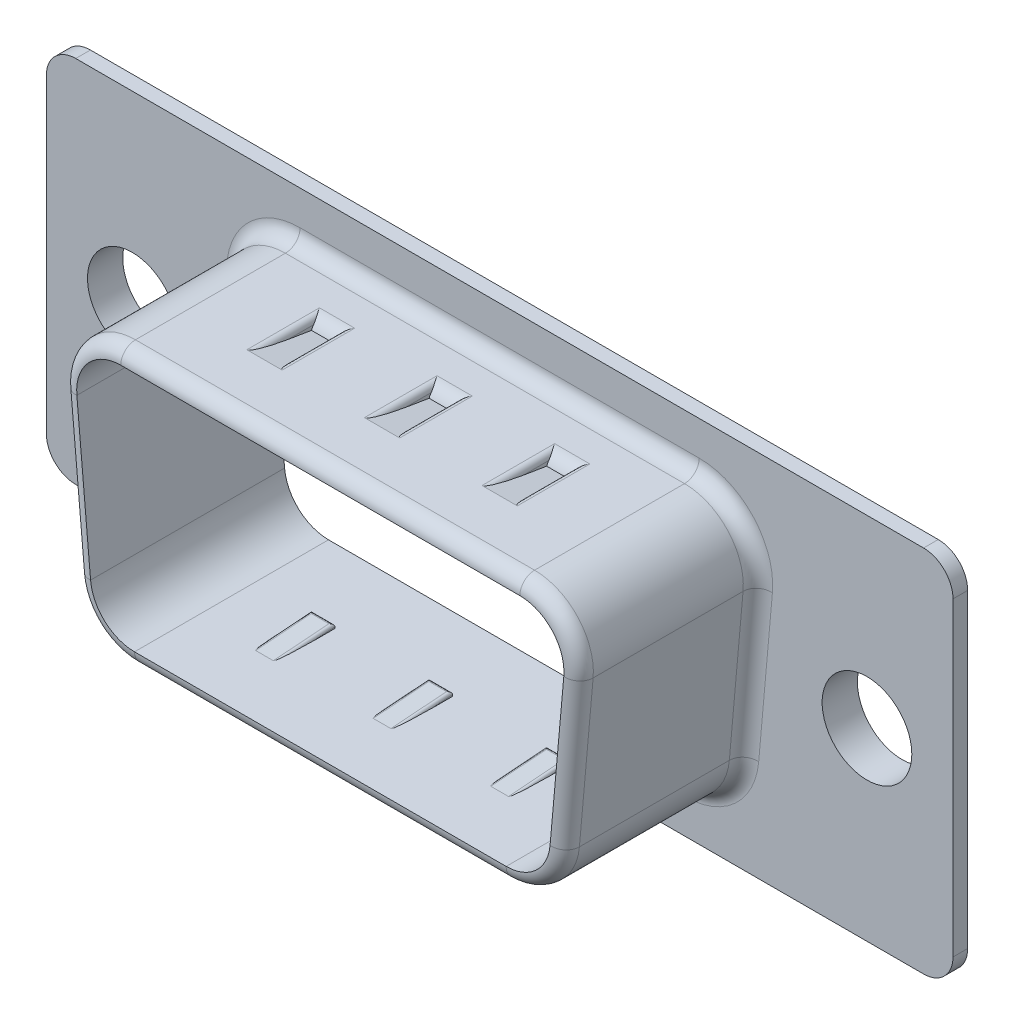
from build123d import *
from build123d.topology import SkipClean

# Parameters (mm, degrees)
BOSS_EXTRUDE1_DEPTH  = 0.5
SKETCH2_R            = 1.525
CUT_EXTRUDE1_DEPTH   = 20.28320582
BOSS_EXTRUDE2_DEPTH  = 6.1
FILLET1_R            = 0.5
CUT_EXTRUDE2_DEPTH   = 14.18320582
FILLET2_R            = 0.5
CUT_EXTRUDE3_DEPTH   = 0.4
LPATTERN1_COUNT      = 2
LPATTERN1_PITCH      = 4
LPATTERN2_COUNT      = 2
LPATTERN2_PITCH      = 4
FILLET3_R            = 0.5
MIRROR1_COPY_1_DEPTH = 0.4
MIRROR1_COPY_2_DEPTH = 0.4
FILLET4_START        = 2.5
FILLET4_DEPTH        = 2
FILLET4_START_2      = 2.029787182
FILLET4_2_DEPTH      = 0.470212818
FILLET4_START_3      = -6
FILLET4_3_DEPTH      = 12
SKETCH9_R            = 1.825
SKETCH9_R_2          = 1.525
BOSS_EXTRUDE3_DEPTH  = 0.5
SKETCH10_R           = 2.025
SKETCH10_R_2         = 1.525
BOSS_EXTRUDE4_DEPTH  = 0.2
BOSS_EXTRUDE5_DEPTH  = 0.4
LPATTERN3_COUNT      = 2
LPATTERN3_PITCH      = 4
LPATTERN4_COUNT      = 2
LPATTERN4_PITCH      = 4
MIRROR2_COPY_1_DEPTH = 0.4
MIRROR2_COPY_2_DEPTH = 0.4
FILLET7_R            = 0.1


with BuildPart() as part:
    # Sketch1 → Boss-Extrude1 (new body)
    with BuildSketch(Plane.XY):
        with BuildLine():
            Line((-14.42, 6.275), (14.42, 6.275))
            ThreePointArc((14.42, 6.275), (15.127106781, 5.982106781), (15.42, 5.275))
            Line((15.42, 5.275), (15.42, -5.275))
            ThreePointArc((15.42, -5.275), (15.127106781, -5.982106781), (14.42, -6.275))
            Line((14.42, -6.275), (-14.42, -6.275))
            ThreePointArc((-14.42, -6.275), (-15.127106781, -5.982106781), (-15.42, -5.275))
            Line((-15.42, -5.275), (-15.42, 5.275))
            ThreePointArc((-15.42, 5.275), (-15.127106781, 5.982106781), (-14.42, 6.275))
        make_face()
    extrude(amount=BOSS_EXTRUDE1_DEPTH)

    # Sketch2 → Cut-Extrude1 (cut)
    with BuildSketch(Plane.XY.offset(0.5)):
        with Locations((-12.495, 0)):
            Circle(SKETCH2_R)
        with Locations((12.495, 0)):
            Circle(SKETCH2_R)
    extrude(amount=-CUT_EXTRUDE1_DEPTH, mode=Mode.SUBTRACT)

    # Sketch3 → Boss-Extrude2 (add)
    with BuildSketch(Plane.XY.offset(0.5)):
        with BuildLine():
            Line((-6.787838979, 4.605), (6.787838979, 4.605))
            ThreePointArc((6.787838979, 4.605), (8.263792445, 3.954652313), (8.779862989, 2.426561367))
            Line((8.779862989, 2.426561367), (8.313169178, -2.783438633))
            ThreePointArc((8.313169178, -2.783438633), (7.670797482, -4.080953466), (6.321145168, -4.605))
            Line((6.321145168, -4.605), (-6.321145168, -4.605))
            ThreePointArc((-6.321145168, -4.605), (-7.670797482, -4.080953466), (-8.313169178, -2.783438633))
            Line((-8.313169178, -2.783438633), (-8.779862989, 2.426561367))
            ThreePointArc((-8.779862989, 2.426561367), (-8.263792445, 3.954652313), (-6.787838979, 4.605))
        make_face()
    extrude(amount=BOSS_EXTRUDE2_DEPTH)

    # Fillet1
    fillet1_edges = [part.edges().sort_by_distance(p)[0] for p in [
        (7.670797482, -4.080953466, 0.5),
        (8.546516083, -0.178438633, 0.5),
        (8.263792445, 3.954652313, 0.5),
        (0, 4.605, 0.5),
        (-8.263792445, 3.954652313, 0.5),
        (-8.546516083, -0.178438633, 0.5),
        (-7.670797482, -4.080953466, 0.5),
        (0, -4.605, 0.5),
    ]]
    fillet(fillet1_edges, radius=FILLET1_R)

    # Sketch4 → Cut-Extrude2 (cut)
    with BuildSketch(Plane.XY.offset(6.6)):
        with BuildLine():
            Line((7.815163175, -2.738828975), (8.281856987, 2.471171025))
            ThreePointArc((8.281856987, 2.471171025), (7.894804079, 3.617239235), (6.787838979, 4.105))
            Line((6.787838979, 4.105), (-6.787838979, 4.105))
            ThreePointArc((-6.787838979, 4.105), (-7.894804079, 3.617239235), (-8.281856987, 2.471171025))
            Line((-8.281856987, 2.471171025), (-7.815163175, -2.738828975))
            ThreePointArc((-7.815163175, -2.738828975), (-7.333384403, -3.711965099), (-6.321145168, -4.105))
            Line((-6.321145168, -4.105), (6.321145168, -4.105))
            ThreePointArc((6.321145168, -4.105), (7.333384403, -3.711965099), (7.815163175, -2.738828975))
        make_face()
    extrude(amount=-CUT_EXTRUDE2_DEPTH, mode=Mode.SUBTRACT)

    # Fillet2
    fillet2_edges = [part.edges().sort_by_distance(p)[0] for p in [
        (7.670797482, -4.080953466, 6.6),
        (8.546516083, -0.178438633, 6.6),
        (8.263792445, 3.954652313, 6.6),
        (0, 4.605, 6.6),
        (-8.263792445, 3.954652313, 6.6),
        (-8.546516083, -0.178438633, 6.6),
        (-7.670797482, -4.080953466, 6.6),
        (0, -4.605, 6.6),
    ]]
    fillet(fillet2_edges, radius=FILLET2_R - 0.0001)  # a hair under: the kernel refuses the full size

    # Sketch8 → Cut-Extrude3 (cut, symmetric)
    with BuildSketch(Plane(origin=(0, 0, 0), x_dir=(0, 0, -1), z_dir=(1, 0, 0))):
        Polygon((-4.5, 4.605), (-2.5, 4.275), (-2.5, 4.605), align=None)
    cut_extrude3 = extrude(amount=CUT_EXTRUDE3_DEPTH, both=True, mode=Mode.SUBTRACT)

    # LPattern1: Cut-Extrude3 ×2
    with Locations(*[(i * LPATTERN1_PITCH, 0, 0) for i in range(1, LPATTERN1_COUNT)]):
        add(cut_extrude3, mode=Mode.SUBTRACT)

    # LPattern2: Cut-Extrude3 ×2
    with Locations(*[(-i * LPATTERN2_PITCH, 0, 0) for i in range(1, LPATTERN2_COUNT)]):
        add(cut_extrude3, mode=Mode.SUBTRACT)

    # Fillet3
    # the kernel refuses this fillet: 0.5 mm, written as the material it takes off along each edge
    with BuildSketch(Plane(origin=(4.4, 4.605, 2.5), x_dir=(0, 0, -1), z_dir=(-1, 0, 0)), Plane(origin=(0.4, 4.605, 2.5), x_dir=(0, 0, -1), z_dir=(-1, 0, 0)), Plane(origin=(-3.6, 4.605, 2.5), x_dir=(0, 0, -1), z_dir=(-1, 0, 0))) as fillet3_piece_1:
        with BuildLine():
            CenterArc((0.470212718, 0.5), FILLET3_R, 199.87687407, 70.12312593)
            Line((0, 0.33), (-0.009404254, 0.3266))
            ThreePointArc((-0.009404254, 0.3266), (-0.01, 0.165), (-0.01, 0))
            Line((-0.01, 0), (0, -0.01))
            Line((0, -0.01), (0.470212718, -0.01))
            Line((0.470212718, -0.01), (0.470212718, 0))
        make_face()
    extrude(amount=0.8, mode=Mode.SUBTRACT)

    # Mirror1: Cut-Extrude3 across plane
    add(cut_extrude3.mirror(Plane.ZX), mode=Mode.SUBTRACT)

    # Mirror1 copy 1 sketch → Mirror1 copy 1 (cut, symmetric)
    with BuildSketch(Plane(origin=(4, 0, 0), x_dir=(0, 0, -1), z_dir=(1, 0, 0))):
        Polygon((-4.5, -4.605), (-2.5, -4.275), (-2.5, -4.605), align=None)
    extrude(amount=MIRROR1_COPY_1_DEPTH, both=True, mode=Mode.SUBTRACT)

    # Mirror1 copy 2 sketch → Mirror1 copy 2 (cut, symmetric)
    with BuildSketch(Plane(origin=(-4, 0, 0), x_dir=(0, 0, -1), z_dir=(1, 0, 0))):
        Polygon((-4.5, -4.605), (-2.5, -4.275), (-2.5, -4.605), align=None)
    extrude(amount=MIRROR1_COPY_2_DEPTH, both=True, mode=Mode.SUBTRACT)

    # Fillet4: read off the stored shape, not the designer's step
    # Fillet4 outline → Fillet4 (cut)
    with BuildSketch(Plane.XY.offset(FILLET4_START)):
        with BuildLine():
            Line((4.4, -4.405), (4.4, -4.605))
            Line((4.4, -4.605), (4.6, -4.605))
            ThreePointArc((4.6, -4.605), (4.458578644, -4.546421356), (4.4, -4.405))
        make_face()
        with BuildLine():
            ThreePointArc((3.6, -4.405), (3.541421356, -4.546421356), (3.4, -4.605))
            Line((3.4, -4.605), (3.6, -4.605))
            Line((3.6, -4.605), (3.6, -4.405))
        make_face()
        with BuildLine():
            Line((0.4, -4.405), (0.4, -4.605))
            Line((0.4, -4.605), (0.6, -4.605))
            ThreePointArc((0.6, -4.605), (0.458578644, -4.546421356), (0.4, -4.405))
        make_face()
        with BuildLine():
            ThreePointArc((-0.4, -4.405), (-0.458578644, -4.546421356), (-0.6, -4.605))
            Line((-0.6, -4.605), (-0.4, -4.605))
            Line((-0.4, -4.605), (-0.4, -4.405))
        make_face()
        with BuildLine():
            Line((-3.6, -4.405), (-3.6, -4.605))
            Line((-3.6, -4.605), (-3.4, -4.605))
            ThreePointArc((-3.4, -4.605), (-3.541421356, -4.546421356), (-3.6, -4.405))
        make_face()
        with BuildLine():
            ThreePointArc((-4.4, -4.405), (-4.458578644, -4.546421356), (-4.6, -4.605))
            Line((-4.6, -4.605), (-4.4, -4.605))
            Line((-4.4, -4.605), (-4.4, -4.405))
        make_face()
        with BuildLine():
            Line((4.6, 4.605), (4.4, 4.605))
            Line((4.4, 4.605), (4.4, 4.405))
            ThreePointArc((4.4, 4.405), (4.458578644, 4.546421356), (4.6, 4.605))
        make_face()
        with BuildLine():
            Line((3.6, 4.605), (3.4, 4.605))
            ThreePointArc((3.4, 4.605), (3.541421356, 4.546421356), (3.6, 4.405))
            Line((3.6, 4.405), (3.6, 4.605))
        make_face()
        with BuildLine():
            Line((0.6, 4.605), (0.4, 4.605))
            Line((0.4, 4.605), (0.4, 4.405))
            ThreePointArc((0.4, 4.405), (0.458578644, 4.546421356), (0.6, 4.605))
        make_face()
        with BuildLine():
            Line((-0.4, 4.605), (-0.6, 4.605))
            ThreePointArc((-0.6, 4.605), (-0.458578644, 4.546421356), (-0.4, 4.405))
            Line((-0.4, 4.405), (-0.4, 4.605))
        make_face()
        with BuildLine():
            Line((-3.4, 4.605), (-3.6, 4.605))
            Line((-3.6, 4.605), (-3.6, 4.405))
            ThreePointArc((-3.6, 4.405), (-3.541421356, 4.546421356), (-3.4, 4.605))
        make_face()
        with BuildLine():
            ThreePointArc((-4.6, 4.605), (-4.458578644, 4.546421356), (-4.4, 4.405))
            Line((-4.4, 4.405), (-4.4, 4.605))
            Line((-4.4, 4.605), (-4.6, 4.605))
        make_face()
    extrude(amount=FILLET4_DEPTH, mode=Mode.SUBTRACT)

    # Fillet4 2 outline → Fillet4 2 (cut)
    with BuildSketch(Plane.XY.offset(FILLET4_START_2)):
        with BuildLine():
            Line((4.6, 4.605), (4.4, 4.605))
            Line((4.4, 4.605), (4.4, 4.405))
            ThreePointArc((4.4, 4.405), (4.458578644, 4.546421356), (4.6, 4.605))
        make_face()
        with BuildLine():
            Line((3.6, 4.605), (3.4, 4.605))
            ThreePointArc((3.4, 4.605), (3.541421356, 4.546421356), (3.6, 4.405))
            Line((3.6, 4.405), (3.6, 4.605))
        make_face()
        with BuildLine():
            Line((0.6, 4.605), (0.4, 4.605))
            Line((0.4, 4.605), (0.4, 4.405))
            ThreePointArc((0.4, 4.405), (0.458578644, 4.546421356), (0.6, 4.605))
        make_face()
        with BuildLine():
            Line((-0.4, 4.605), (-0.6, 4.605))
            ThreePointArc((-0.6, 4.605), (-0.458578644, 4.546421356), (-0.4, 4.405))
            Line((-0.4, 4.405), (-0.4, 4.605))
        make_face()
        with BuildLine():
            Line((-3.4, 4.605), (-3.6, 4.605))
            Line((-3.6, 4.605), (-3.6, 4.405))
            ThreePointArc((-3.6, 4.405), (-3.541421356, 4.546421356), (-3.4, 4.605))
        make_face()
        with BuildLine():
            ThreePointArc((-4.6, 4.605), (-4.458578644, 4.546421356), (-4.4, 4.405))
            Line((-4.4, 4.405), (-4.4, 4.605))
            Line((-4.4, 4.605), (-4.6, 4.605))
        make_face()
    extrude(amount=FILLET4_2_DEPTH, mode=Mode.SUBTRACT)

    # Fillet4 3 outline → Fillet4 3 (add)
    with SkipClean():  # the faces are left unmerged after this step: merging them gives an invalid solid
        with BuildSketch(Plane.YZ.offset(FILLET4_START_3)):
            Polygon((4.405, 4.5), (4.405, 3.287878788), (4.605, 4.5), align=None)
            with BuildLine():
                Line((4.405, 2.429787282), (4.405, 2.029787182))
                Line((4.405, 2.029787182), (4.605, 2.029787282))
                ThreePointArc((4.605, 2.029787282), (4.552213595, 2.25339408), (4.405, 2.429787282))
            make_face()
            Polygon((-4.405, 4.5), (-4.605, 4.5), (-4.405, 3.287878788), align=None)
        extrude(amount=FILLET4_3_DEPTH)

    # Sketch9 → Boss-Extrude3 (add)
    # profile 1 of 2: a face of its own
    with BuildSketch(Plane(origin=(0, 0, 0), x_dir=(-1, 0, 0), z_dir=(0, 0, -1))):
        with Locations((-12.495, 0)):
            Circle(SKETCH9_R)
        with Locations(Location((-12.495, 0, 0), (0, 0, 180))):
            Circle(SKETCH9_R_2, mode=Mode.SUBTRACT)
    # profile 2 of 2: a face of its own
    with BuildSketch(Plane(origin=(0, 0, 0), x_dir=(-1, 0, 0), z_dir=(0, 0, -1))):
        with Locations((12.495, 0)):
            Circle(SKETCH9_R)
        with Locations(Location((12.495, 0, 0), (0, 0, 180))):
            Circle(SKETCH9_R_2, mode=Mode.SUBTRACT)
    extrude(amount=BOSS_EXTRUDE3_DEPTH)

    # Sketch10 → Boss-Extrude4 (add)
    # profile 1 of 2: a face of its own
    with BuildSketch(Plane(origin=(0, 0, -0.5), x_dir=(-1, 0, 0), z_dir=(0, 0, -1))):
        with Locations((-12.495, 0)):
            Circle(SKETCH10_R)
        with Locations(Location((-12.495, 0, 0), (0, 0, 180))):
            Circle(SKETCH10_R_2, mode=Mode.SUBTRACT)
    # profile 2 of 2: a face of its own
    with BuildSketch(Plane(origin=(0, 0, -0.5), x_dir=(-1, 0, 0), z_dir=(0, 0, -1))):
        with Locations((12.495, 0)):
            Circle(SKETCH10_R)
        with Locations(Location((12.495, 0, 0), (0, 0, 180))):
            Circle(SKETCH10_R_2, mode=Mode.SUBTRACT)
    extrude(amount=BOSS_EXTRUDE4_DEPTH)

    # Sketch13 → Boss-Extrude5 (add, symmetric)
    with BuildSketch(Plane(origin=(0, 0, 0), x_dir=(0, 0, -1), z_dir=(1, 0, 0))):
        Polygon((-2.5, 4.105), (-4.5, 4.105), (-2.5, 3.955), align=None)
    boss_extrude5 = extrude(amount=BOSS_EXTRUDE5_DEPTH, both=True)

    # LPattern3: Boss-Extrude5 ×2
    with Locations(*[(-i * LPATTERN3_PITCH, 0, 0) for i in range(1, LPATTERN3_COUNT)]):
        add(boss_extrude5)

    # LPattern4: Boss-Extrude5 ×2
    with Locations(*[(i * LPATTERN4_PITCH, 0, 0) for i in range(1, LPATTERN4_COUNT)]):
        add(boss_extrude5)

    # Mirror2: Boss-Extrude5 across plane
    add(boss_extrude5.mirror(Plane.ZX))

    # Mirror2 copy 1 sketch → Mirror2 copy 1 (add, symmetric)
    with BuildSketch(Plane(origin=(-4, 0, 0), x_dir=(0, 0, -1), z_dir=(1, 0, 0))):
        Polygon((-2.5, -4.105), (-4.5, -4.105), (-2.5, -3.955), align=None)
    extrude(amount=MIRROR2_COPY_1_DEPTH, both=True)

    # Mirror2 copy 2 sketch → Mirror2 copy 2 (add, symmetric)
    with BuildSketch(Plane(origin=(4, 0, 0), x_dir=(0, 0, -1), z_dir=(1, 0, 0))):
        Polygon((-2.5, -4.105), (-4.5, -4.105), (-2.5, -3.955), align=None)
    extrude(amount=MIRROR2_COPY_2_DEPTH, both=True)

    # Fillet7
    # the kernel refuses this fillet: 0.1 mm, written as the material it takes off along each edge
    with BuildSketch(Plane(origin=(0.669452139, 3.955, 2.5), x_dir=(0, 1, 0), z_dir=(-1, 0, 0)), Plane(origin=(-3.330547861, 3.955, 2.5), x_dir=(0, 1, 0), z_dir=(-1, 0, 0)), Plane(origin=(-4.669452139, -3.955, 2.5), x_dir=(0, -1, 0), z_dir=(1, 0, 0)), Plane(origin=(3.330547861, -3.955, 2.5), x_dir=(0, -1, 0), z_dir=(1, 0, 0))) as fillet7_piece_1:
        with BuildLine():
            CenterArc((FILLET7_R * 1.07780855601, -FILLET7_R), FILLET7_R, 90, 94.289153329)
            Line((FILLET7_R * 0.0806092461181, -FILLET7_R * 1.07478994824), (0, 0))
            Line((0, 0), (FILLET7_R * 1.07780855601, 0))
        make_face()
    extrude(amount=1.338904278, mode=Mode.SUBTRACT)
    with BuildSketch(Plane(origin=(-0.4, 4.123697487, 4.749299827), x_dir=(0, 0.9971993098884564, -0.07478994824163439), z_dir=(0, -0.07478994824163439, -0.9971993098884564))) as fillet7_piece_2_section:
        with BuildLine():
            CenterArc((FILLET7_R, FILLET7_R), FILLET7_R, 180, 90)
            Line((0, FILLET7_R), (0, 0))
            Line((0, 0), (FILLET7_R, 0))
        make_face()
    fillet7_piece_2 = extrude(amount=2.505617112, mode=Mode.PRIVATE)
    fillet7_piece_2 = split(fillet7_piece_2, bisect_by=Plane(origin=(-0.4, 4.105, 4.749299827), z_dir=(0, -1, 0)), keep=Keep.TOP, mode=Mode.PRIVATE)
    add(fillet7_piece_2, mode=Mode.SUBTRACT)
    with BuildSketch(Plane(origin=(0.4, 4.123697487, 4.749299827), x_dir=(-1, 0, 0), z_dir=(0, -0.07478994824163439, -0.9971993098884564))) as fillet7_piece_3_section:
        with BuildLine():
            CenterArc((FILLET7_R, FILLET7_R), FILLET7_R, 180, 90)
            Line((0, FILLET7_R), (0, 0))
            Line((0, 0), (FILLET7_R, 0))
        make_face()
    fillet7_piece_3 = extrude(amount=2.505617112, mode=Mode.PRIVATE)
    fillet7_piece_3 = split(fillet7_piece_3, bisect_by=Plane(origin=(0.4, 4.105, 4.749299827), z_dir=(0, -1, 0)), keep=Keep.TOP, mode=Mode.PRIVATE)
    add(fillet7_piece_3, mode=Mode.SUBTRACT)
    with BuildSketch(Plane(origin=(-4.4, 4.123697487, 4.749299827), x_dir=(0, 0.9971993098884564, -0.07478994824163439), z_dir=(0, -0.07478994824163439, -0.9971993098884564))) as fillet7_piece_4_section:
        with BuildLine():
            CenterArc((FILLET7_R, FILLET7_R), FILLET7_R, 180, 90)
            Line((0, FILLET7_R), (0, 0))
            Line((0, 0), (FILLET7_R, 0))
        make_face()
    fillet7_piece_4 = extrude(amount=2.505617112, mode=Mode.PRIVATE)
    fillet7_piece_4 = split(fillet7_piece_4, bisect_by=Plane(origin=(-4.4, 4.105, 4.749299827), z_dir=(0, -1, 0)), keep=Keep.TOP, mode=Mode.PRIVATE)
    add(fillet7_piece_4, mode=Mode.SUBTRACT)
    with BuildSketch(Plane(origin=(-3.6, 4.123697487, 4.749299827), x_dir=(-1, 0, 0), z_dir=(0, -0.07478994824163439, -0.9971993098884564))) as fillet7_piece_5_section:
        with BuildLine():
            CenterArc((FILLET7_R, FILLET7_R), FILLET7_R, 180, 90)
            Line((0, FILLET7_R), (0, 0))
            Line((0, 0), (FILLET7_R, 0))
        make_face()
    fillet7_piece_5 = extrude(amount=2.505617112, mode=Mode.PRIVATE)
    fillet7_piece_5 = split(fillet7_piece_5, bisect_by=Plane(origin=(-3.6, 4.105, 4.749299827), z_dir=(0, -1, 0)), keep=Keep.TOP, mode=Mode.PRIVATE)
    add(fillet7_piece_5, mode=Mode.SUBTRACT)
    with BuildSketch(Plane(origin=(4.669452139, 3.955, 2.5), x_dir=(0, 0.07478994824163587, 0.9971993098884563), z_dir=(-1, 0, 0)), Plane(origin=(0.669452139, -3.955, 2.5), x_dir=(0, -1, 0), z_dir=(-1, 0, 0))) as fillet7_piece_6:
        with BuildLine():
            CenterArc((FILLET7_R * 1.07780855601, FILLET7_R), FILLET7_R, 175.710846671, 94.289153329)
            Line((FILLET7_R * 0.0806092461181, FILLET7_R * 1.07478994824), (0, 0))
            Line((0, 0), (FILLET7_R * 1.07780855601, 0))
        make_face()
    extrude(amount=1.338904278, mode=Mode.SUBTRACT)
    with BuildSketch(Plane(origin=(3.6, 4.123697487, 4.749299827), x_dir=(0, 0.9971993098884564, -0.07478994824163439), z_dir=(0, -0.07478994824163439, -0.9971993098884564))) as fillet7_piece_7_section:
        with BuildLine():
            CenterArc((FILLET7_R, FILLET7_R), FILLET7_R, 180, 90)
            Line((0, FILLET7_R), (0, 0))
            Line((0, 0), (FILLET7_R, 0))
        make_face()
    fillet7_piece_7 = extrude(amount=2.505617112, mode=Mode.PRIVATE)
    fillet7_piece_7 = split(fillet7_piece_7, bisect_by=Plane(origin=(3.6, 4.105, 4.749299827), z_dir=(0, -1, 0)), keep=Keep.TOP, mode=Mode.PRIVATE)
    add(fillet7_piece_7, mode=Mode.SUBTRACT)
    with BuildSketch(Plane(origin=(4.4, 4.123697487, 4.749299827), x_dir=(-1, 0, 0), z_dir=(0, -0.07478994824163439, -0.9971993098884564))) as fillet7_piece_8_section:
        with BuildLine():
            CenterArc((FILLET7_R, FILLET7_R), FILLET7_R, 180, 90)
            Line((0, FILLET7_R), (0, 0))
            Line((0, 0), (FILLET7_R, 0))
        make_face()
    fillet7_piece_8 = extrude(amount=2.505617112, mode=Mode.PRIVATE)
    fillet7_piece_8 = split(fillet7_piece_8, bisect_by=Plane(origin=(4.4, 4.105, 4.749299827), z_dir=(0, -1, 0)), keep=Keep.TOP, mode=Mode.PRIVATE)
    add(fillet7_piece_8, mode=Mode.SUBTRACT)
    with BuildSketch(Plane(origin=(0.4, -4.123697487, 4.749299827), x_dir=(0, -0.9971993098884564, -0.07478994824163439), z_dir=(0, 0.07478994824163439, -0.9971993098884564))) as fillet7_piece_9_section:
        with BuildLine():
            CenterArc((FILLET7_R, FILLET7_R), FILLET7_R, 180, 90)
            Line((0, FILLET7_R), (0, 0))
            Line((0, 0), (FILLET7_R, 0))
        make_face()
    fillet7_piece_9 = extrude(amount=2.505617112, mode=Mode.PRIVATE)
    fillet7_piece_9 = split(fillet7_piece_9, bisect_by=Plane(origin=(0.4, -4.105, 4.749299827), z_dir=(0, 1, 0)), keep=Keep.TOP, mode=Mode.PRIVATE)
    add(fillet7_piece_9, mode=Mode.SUBTRACT)
    with BuildSketch(Plane(origin=(-0.4, -4.123697487, 4.749299827), x_dir=(0, -0.9971993098884564, -0.07478994824163439), z_dir=(0, 0.07478994824163439, -0.9971993098884564))) as fillet7_piece_10_section:
        with BuildLine():
            CenterArc((FILLET7_R, -FILLET7_R), FILLET7_R, 90, 90)
            Line((0, -FILLET7_R), (0, 0))
            Line((0, 0), (FILLET7_R, 0))
        make_face()
    fillet7_piece_10 = extrude(amount=2.505617112, mode=Mode.PRIVATE)
    fillet7_piece_10 = split(fillet7_piece_10, bisect_by=Plane(origin=(-0.4, -4.105, 4.749299827), z_dir=(0, 1, 0)), keep=Keep.TOP, mode=Mode.PRIVATE)
    add(fillet7_piece_10, mode=Mode.SUBTRACT)
    with BuildSketch(Plane(origin=(-3.6, -4.123697487, 4.749299827), x_dir=(0, -0.9971993098884564, -0.07478994824163439), z_dir=(0, 0.07478994824163439, -0.9971993098884564))) as fillet7_piece_11_section:
        with BuildLine():
            CenterArc((FILLET7_R, FILLET7_R), FILLET7_R, 180, 90)
            Line((0, FILLET7_R), (0, 0))
            Line((0, 0), (FILLET7_R, 0))
        make_face()
    fillet7_piece_11 = extrude(amount=2.505617112, mode=Mode.PRIVATE)
    fillet7_piece_11 = split(fillet7_piece_11, bisect_by=Plane(origin=(-3.6, -4.105, 4.749299827), z_dir=(0, 1, 0)), keep=Keep.TOP, mode=Mode.PRIVATE)
    add(fillet7_piece_11, mode=Mode.SUBTRACT)
    with BuildSketch(Plane(origin=(-4.4, -4.123697487, 4.749299827), x_dir=(0, -0.9971993098884564, -0.07478994824163439), z_dir=(0, 0.07478994824163439, -0.9971993098884564))) as fillet7_piece_12_section:
        with BuildLine():
            CenterArc((FILLET7_R, -FILLET7_R), FILLET7_R, 90, 90)
            Line((0, -FILLET7_R), (0, 0))
            Line((0, 0), (FILLET7_R, 0))
        make_face()
    fillet7_piece_12 = extrude(amount=2.505617112, mode=Mode.PRIVATE)
    fillet7_piece_12 = split(fillet7_piece_12, bisect_by=Plane(origin=(-4.4, -4.105, 4.749299827), z_dir=(0, 1, 0)), keep=Keep.TOP, mode=Mode.PRIVATE)
    add(fillet7_piece_12, mode=Mode.SUBTRACT)
    with BuildSketch(Plane(origin=(4.4, -4.123697487, 4.749299827), x_dir=(0, -0.9971993098884564, -0.07478994824163439), z_dir=(0, 0.07478994824163439, -0.9971993098884564))) as fillet7_piece_13_section:
        with BuildLine():
            CenterArc((FILLET7_R, FILLET7_R), FILLET7_R, 180, 90)
            Line((0, FILLET7_R), (0, 0))
            Line((0, 0), (FILLET7_R, 0))
        make_face()
    fillet7_piece_13 = extrude(amount=2.505617112, mode=Mode.PRIVATE)
    fillet7_piece_13 = split(fillet7_piece_13, bisect_by=Plane(origin=(4.4, -4.105, 4.749299827), z_dir=(0, 1, 0)), keep=Keep.TOP, mode=Mode.PRIVATE)
    add(fillet7_piece_13, mode=Mode.SUBTRACT)
    with BuildSketch(Plane(origin=(3.6, -4.123697487, 4.749299827), x_dir=(1, 0, 0), z_dir=(0, 0.07478994824163439, -0.9971993098884564))) as fillet7_piece_14_section:
        with BuildLine():
            CenterArc((FILLET7_R, FILLET7_R), FILLET7_R, 180, 90)
            Line((0, FILLET7_R), (0, 0))
            Line((0, 0), (FILLET7_R, 0))
        make_face()
    fillet7_piece_14 = extrude(amount=2.505617112, mode=Mode.PRIVATE)
    fillet7_piece_14 = split(fillet7_piece_14, bisect_by=Plane(origin=(3.6, -4.105, 4.749299827), z_dir=(0, 1, 0)), keep=Keep.TOP, mode=Mode.PRIVATE)
    add(fillet7_piece_14, mode=Mode.SUBTRACT)


solid = part.part
